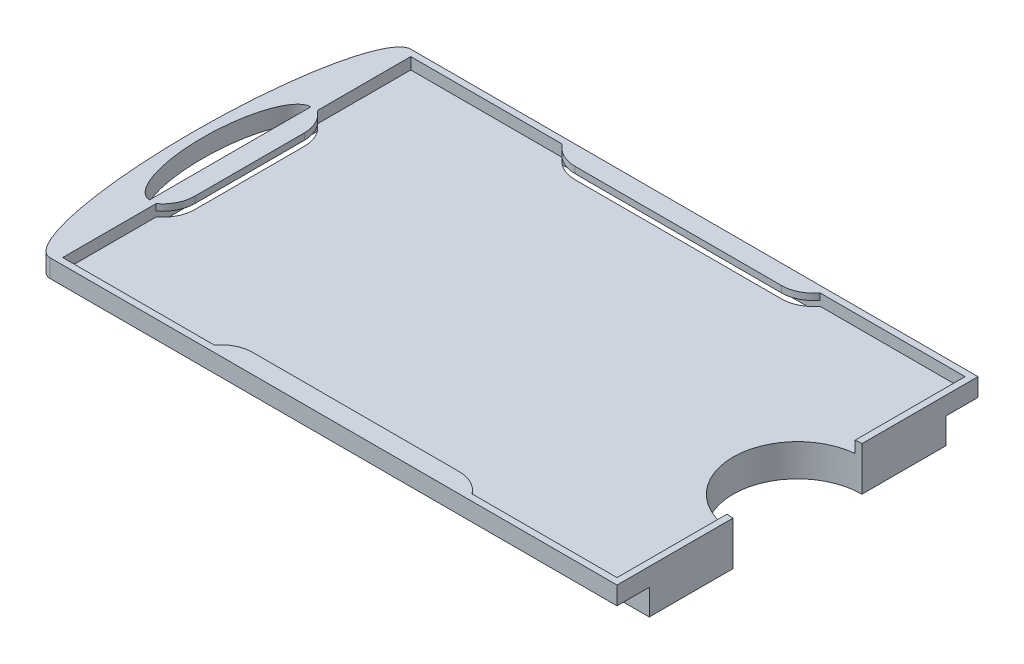
from build123d import *

# Parameters (mm, degrees)
IZIM1_W                     = 88
IZIM1_H                     = 56
Y_KSEKLIK_EKSTR_ZYON1_DEPTH = 2.8
BO_ALTMA1_T                 = -1
IZIM3_R                     = 10
KES_EKSTR_ZYON2_DEPTH       = 30.7
IZIM4_W                     = 40
IZIM4_H                     = 3
IZIM4_W_2                   = 3
IZIM4_H_2                   = 25
Y_KSEKLIK_EKSTR_ZYON2_DEPTH = 1
RADYUS1_R                   = 5
KES_EKSTR_ZYON3_DEPTH       = 31
Y_KSEKLIK_EKSTR_ZYON5_DEPTH = 4
IZIM7_R                     = 0.75
Y_KSEKLIK_EKSTR_ZYON4_DEPTH = 4
IZIM11_R                    = 1
KES_EKSTR_ZYON4_DEPTH       = 100
Y_KSEKLIK_EKSTR_ZYON6_DEPTH = 2.8


with BuildPart() as part:
    # Çizim1 → Yükseklik-Ekstrüzyon1 (new body)
    with BuildSketch(Plane(origin=(0, 0, 0), x_dir=(1, 0, 0), z_dir=(0, 1, 0))):
        with Locations((-2.116392696, -12.102112676)):
            Rectangle(IZIM1_W, IZIM1_H)
    extrude(amount=Y_KSEKLIK_EKSTR_ZYON1_DEPTH)

    # İç Boşaltma1
    bo_altma1_openings = [part.faces().sort_by_distance(p)[0] for p in [
        (-2.116392696, 2.8, 12.102112676),
    ]]
    offset(amount=BO_ALTMA1_T, openings=bo_altma1_openings, kind=Kind.INTERSECTION)

    # Çizim3 → Kes-Ekstrüzyon2 (cut)
    with BuildSketch(Plane(origin=(0, 2.8, 0), x_dir=(1, 0, 0), z_dir=(0, 1, 0))):
        with Locations((41.883607304, -12.102112676)):
            Circle(IZIM3_R)
    extrude(amount=-KES_EKSTR_ZYON2_DEPTH, mode=Mode.SUBTRACT)

    # Çizim4 → Yükseklik-Ekstrüzyon2 (add)
    with BuildSketch(Plane(origin=(0, 2.8, 0), x_dir=(1, 0, 0), z_dir=(0, 1, 0))):
        with Locations((-1.616392696, 14.397887324)):
            Rectangle(IZIM4_W, IZIM4_H)
        with Locations((-1.616392696, -38.602112676)):
            Rectangle(IZIM4_W, IZIM4_H)
        with Locations((-44.616392696, -12.102112676)):
            Rectangle(IZIM4_W_2, IZIM4_H_2)
    extrude(amount=-Y_KSEKLIK_EKSTR_ZYON2_DEPTH)

    # Radyus1
    # the kernel refuses this fillet: 5 mm, written as the material it takes off along each edge
    with BuildSketch(Plane(origin=(18.383607304, 12.8, -12.897887324), x_dir=(-1, 0, 0), z_dir=(0, -1, 0))) as radyus1_piece_1_section:
        with BuildLine():
            CenterArc((4, 5), RADYUS1_R, 216.869897646, 53.130102354)
            Line((0, 2), (0, 0))
            Line((0, 0), (4, 0))
        make_face()
    radyus1_piece_1 = extrude(amount=21, mode=Mode.PRIVATE)
    radyus1_piece_1 = split(radyus1_piece_1, bisect_by=Plane(origin=(16.624147417, 1, -13.416807097), z_dir=(0, 1, 0)), keep=Keep.TOP, mode=Mode.PRIVATE)
    add(radyus1_piece_1, mode=Mode.SUBTRACT)
    with BuildSketch(Plane(origin=(-21.616392696, 12.8, -12.897887324), x_dir=(0, 0, -1), z_dir=(0, -1, 0))) as radyus1_piece_2_section:
        with BuildLine():
            CenterArc((5, 4), RADYUS1_R, 180, 53.130102354)
            Line((0, 4), (0, 0))
            Line((0, 0), (2, 0))
        make_face()
    radyus1_piece_2 = extrude(amount=21, mode=Mode.PRIVATE)
    radyus1_piece_2 = split(radyus1_piece_2, bisect_by=Plane(origin=(-19.85693281, 1, -13.416807097), z_dir=(0, 1, 0)), keep=Keep.TOP, mode=Mode.PRIVATE)
    add(radyus1_piece_2, mode=Mode.SUBTRACT)
    with BuildSketch(Plane(origin=(-21.616392696, 12.8, 37.102112676), x_dir=(1, 0, 0), z_dir=(0, -1, 0))) as radyus1_piece_3_section:
        with BuildLine():
            CenterArc((4, 5), RADYUS1_R, 216.869897646, 53.130102354)
            Line((0, 2), (0, 0))
            Line((0, 0), (4, 0))
        make_face()
    radyus1_piece_3 = extrude(amount=21, mode=Mode.PRIVATE)
    radyus1_piece_3 = split(radyus1_piece_3, bisect_by=Plane(origin=(-19.85693281, 1, 37.621032449), z_dir=(0, 1, 0)), keep=Keep.TOP, mode=Mode.PRIVATE)
    add(radyus1_piece_3, mode=Mode.SUBTRACT)
    with BuildSketch(Plane(origin=(18.383607304, 12.8, 37.102112676), x_dir=(0, 0, 1), z_dir=(0, -1, 0))) as radyus1_piece_4_section:
        with BuildLine():
            CenterArc((5, 4), RADYUS1_R, 180, 53.130102354)
            Line((0, 4), (0, 0))
            Line((0, 0), (2, 0))
        make_face()
    radyus1_piece_4 = extrude(amount=21, mode=Mode.PRIVATE)
    radyus1_piece_4 = split(radyus1_piece_4, bisect_by=Plane(origin=(16.624147417, 1, 37.621032449), z_dir=(0, 1, 0)), keep=Keep.TOP, mode=Mode.PRIVATE)
    add(radyus1_piece_4, mode=Mode.SUBTRACT)
    with BuildSketch(Plane(origin=(-43.116392696, 12.8, 24.602112676), x_dir=(-1, 0, 0), z_dir=(0, -1, 0))) as radyus1_piece_5_section:
        with BuildLine():
            CenterArc((5, 4), RADYUS1_R, 180, 53.130102354)
            Line((0, 4), (0, 0))
            Line((0, 0), (2, 0))
        make_face()
    radyus1_piece_5 = extrude(amount=21, mode=Mode.PRIVATE)
    radyus1_piece_5 = split(radyus1_piece_5, bisect_by=Plane(origin=(-43.635312469, 1, 22.84265279), z_dir=(0, 1, 0)), keep=Keep.TOP, mode=Mode.PRIVATE)
    add(radyus1_piece_5, mode=Mode.SUBTRACT)
    with BuildSketch(Plane(origin=(-43.116392696, 12.8, -0.397887324), x_dir=(0, 0, 1), z_dir=(0, -1, 0))) as radyus1_piece_6_section:
        with BuildLine():
            CenterArc((4, 5), RADYUS1_R, 216.869897646, 53.130102354)
            Line((0, 2), (0, 0))
            Line((0, 0), (4, 0))
        make_face()
    radyus1_piece_6 = extrude(amount=21, mode=Mode.PRIVATE)
    radyus1_piece_6 = split(radyus1_piece_6, bisect_by=Plane(origin=(-43.635312469, 1, 1.361572563), z_dir=(0, 1, 0)), keep=Keep.TOP, mode=Mode.PRIVATE)
    add(radyus1_piece_6, mode=Mode.SUBTRACT)

    # Çizim5 → Kes-Ekstrüzyon3 (cut)
    with BuildSketch(Plane(origin=(0, 1.8, 0), x_dir=(-1, 0, 0), z_dir=(0, -1, 0))):
        with BuildLine():
            Line((21.616392696, 14.897887324), (-18.383607304, 14.897887324))
            ThreePointArc((-18.383607304, 14.897887324), (-16.619675281, 13.425751369), (-14.383607304, 12.897887324))
            Line((-14.383607304, 12.897887324), (17.616392696, 12.897887324))
            ThreePointArc((17.616392696, 12.897887324), (19.852460674, 13.425751369), (21.616392696, 14.897887324))
        make_face()
        with BuildLine():
            Line((-18.383607304, -39.102112676), (21.616392696, -39.102112676))
            ThreePointArc((21.616392696, -39.102112676), (19.852460674, -37.629976721), (17.616392696, -37.102112676))
            Line((17.616392696, -37.102112676), (-14.383607304, -37.102112676))
            ThreePointArc((-14.383607304, -37.102112676), (-16.619675281, -37.629976721), (-18.383607304, -39.102112676))
        make_face()
        with BuildLine():
            Line((43.116392696, -3.602112676), (43.116392696, -20.602112676))
            ThreePointArc((43.116392696, -20.602112676), (43.644256741, -22.838180654), (45.116392696, -24.602112676))
            Line((45.116392696, -24.602112676), (45.116392696, 0.397887324))
            ThreePointArc((45.116392696, 0.397887324), (43.644256741, -1.366044699), (43.116392696, -3.602112676))
        make_face()
    extrude(amount=KES_EKSTR_ZYON3_DEPTH, mode=Mode.SUBTRACT)

    # Çizim8 → Yükseklik-Ekstrüzyon5 (add)
    with BuildSketch(Plane.XZ):
        with BuildLine():
            Line((41.883607304, 22.102112676), (41.883607304, 35.102112676))
            Line((41.883607304, 35.102112676), (-41.116392696, 35.102112676))
            Line((-41.116392696, 35.102112676), (-41.116392696, -10.897887324))
            Line((-41.116392696, -10.897887324), (41.883607304, -10.897887324))
            Line((41.883607304, -10.897887324), (41.883607304, 2.102112676))
            ThreePointArc((41.883607304, 2.102112676), (31.883607304, 12.102112676), (41.883607304, 22.102112676))
        make_face()
        with BuildLine():
            Line((39.883607304, 33.102112676), (39.883607304, 23.934272242))
            ThreePointArc((39.883607304, 23.934272242), (29.883607304, 12.102112676), (39.883607304, 0.26995311))
            Line((39.883607304, 0.26995311), (39.883607304, -8.897887324))
            Line((39.883607304, -8.897887324), (14.383607304, -8.897887324))
            Line((14.383607304, -8.897887324), (-17.616392696, -8.897887324))
            Line((-17.616392696, -8.897887324), (-39.116392696, -8.897887324))
            Line((-39.116392696, -8.897887324), (-39.116392696, 4.369696826))
            Line((-39.116392696, 4.369696826), (-39.116392696, 21.402895856))
            Line((-39.116392696, 21.402895856), (-39.116392696, 33.102112676))
            Line((-39.116392696, 33.102112676), (-17.877937152, 33.102112676))
            Line((-17.877937152, 33.102112676), (14.321922447, 33.102112676))
            Line((14.321922447, 33.102112676), (39.883607304, 33.102112676))
        make_face(mode=Mode.SUBTRACT)
    extrude(amount=Y_KSEKLIK_EKSTR_ZYON5_DEPTH)

    # Çizim7 → Yükseklik-Ekstrüzyon4 (add)
    with BuildSketch(Plane.XZ):
        with Locations(Location((-18.250131222, 0.919644732, 0), (0, 0, 270))):
            Circle(IZIM7_R)
        with Locations(Location((-19.200131222, 24.214026494, 0), (0, 0, 270))):
            Circle(IZIM7_R)
    extrude(amount=Y_KSEKLIK_EKSTR_ZYON4_DEPTH)

    # Çizim11 → Kes-Ekstrüzyon4 (cut)
    with BuildSketch(Plane(origin=(0, 0, -10.897887324), x_dir=(-1, 0, 0), z_dir=(0, 0, -1))):
        with Locations((1.616392696, -2)):
            Circle(IZIM11_R)
    extrude(amount=-KES_EKSTR_ZYON4_DEPTH, mode=Mode.SUBTRACT)

    # Çizim12 → Yükseklik-Ekstrüzyon6 (add)
    with BuildSketch(Plane(origin=(0, 2.8, 0), x_dir=(1, 0, 0), z_dir=(0, 1, 0))):
        with BuildLine():
            add(Edge.make_bspline(
                [(-46.116392696, 15.897887324), (-51.885455942, 15.897887324), (-51.885455942, -12.102112676), (-51.885455942, -40.102112676), (-46.116392696, -40.102112676)],
                knots=[0, 0, 0, 1.570796327, 1.570796327, 3.141592654, 3.141592654, 3.141592654], degree=2, weights=[1, 0.707106781, 1, 0.707106781, 1]))
            Line((-46.116392696, -40.102112676), (-46.116392696, -24.602112676))
            add(Edge.make_bspline(
                [(-46.116392696, 0.397887324), (-50.380176038, 0.397887324), (-50.380176038, -12.102112676), (-50.380176038, -24.602112676), (-46.116392696, -24.602112676)],
                knots=[0, 0, 0, 1.570796327, 1.570796327, 3.141592654, 3.141592654, 3.141592654], degree=2, weights=[1, 0.707106781, 1, 0.707106781, 1]))
            Line((-46.116392696, 0.397887324), (-46.116392696, 15.897887324))
        make_face()
    extrude(amount=-Y_KSEKLIK_EKSTR_ZYON6_DEPTH)


solid = part.part
